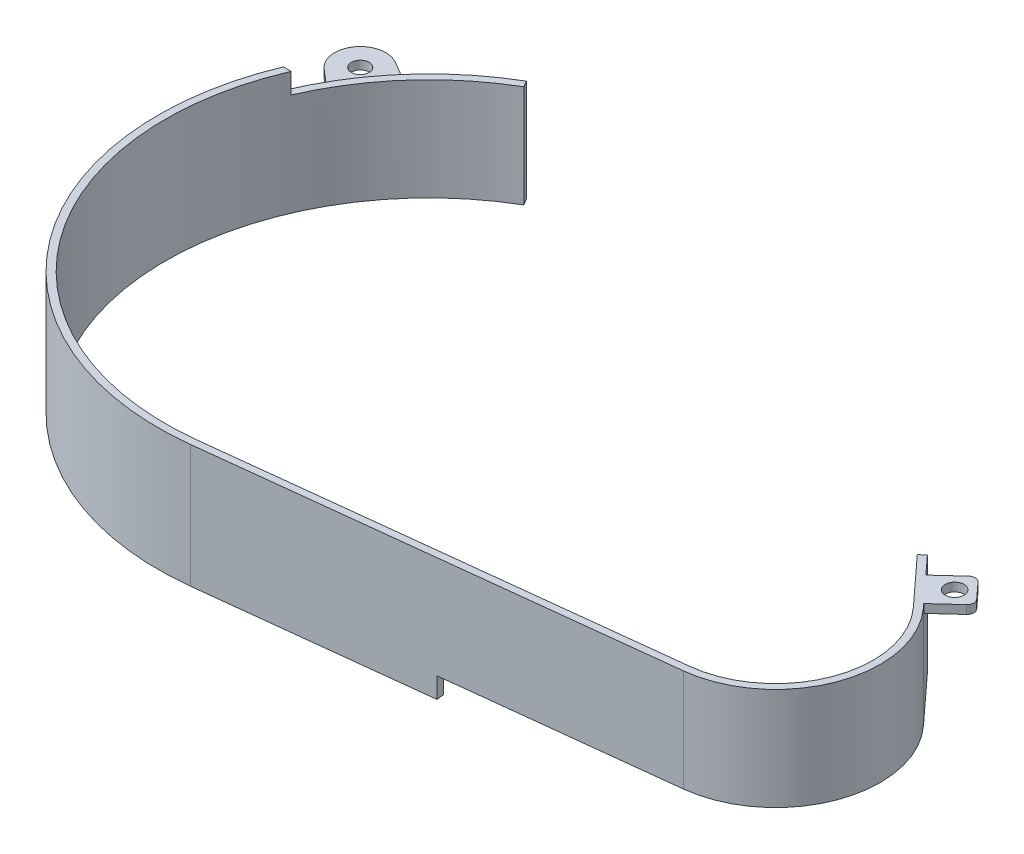
from build123d import *
from build123d.topology import SkipClean

# Parameters (mm, degrees)
BASE_FLANGE1_DEPTH  = 38.1
CUT_EXTRUDE1_DEPTH  = 7.62
BOSS_EXTRUDE1_DEPTH = 3.175
BOSS_EXTRUDE2_DEPTH = 7.62
SKETCH11_R          = 3.5
BOSS_EXTRUDE3_DEPTH = 3.175


# Sheet-metal steps are written as plain solids
with BuildPart() as part:
    # Sketch1 → Base-Flange1 (new body)
    with BuildSketch(Plane(origin=(0, 0, 0), x_dir=(1, 0, 0), z_dir=(0, 1, 0))):
        with BuildLine():
            Line((-658.18839, -181.815019342), (-493.414651072, -163.065661223))
            ThreePointArc((-493.414651072, -163.065661223), (-463.516823985, -139.706651468), (-470.767754496, -102.464908652))
            Line((-470.767754496, -102.464908652), (-487.062469778, -84.698684743))
            Line((-487.062469778, -84.698684743), (-485.096976273, -82.895985576))
            Line((-485.096976273, -82.895985576), (-468.802260992, -100.662209486))
            ThreePointArc((-468.802260992, -100.662209486), (-461.018573288, -140.640264051), (-493.113122906, -165.715561177))
            Line((-493.113122906, -165.715561177), (-657.886861835, -184.464919296))
            ThreePointArc((-657.886861835, -184.464919296), (-764.999542035, -116.070482162), (-720.157705771, 2.841817501))
            Line((-720.157705771, 2.841817501), (-718.812633408, 0.538847823))
            ThreePointArc((-718.812633408, 0.538847823), (-762.468736724, -115.229106217), (-658.18839, -181.815019342))
        make_face()
    extrude(amount=-BASE_FLANGE1_DEPTH)

    # Sketch7 → Cut-Extrude1 (cut)
    with BuildSketch(Plane(origin=(-720.157705771, 0, -2.841817501), x_dir=(1, 0, 0), z_dir=(0, 1, 0))):
        with BuildLine():
            Line((1.345072363, -2.302969678), (0, 0))
            ThreePointArc((0, 0), (-25.04555192, -20.685894616), (-42.216883241, -48.26))
            Line((-42.216883241, -48.26), (-39.320240627, -48.26))
            ThreePointArc((-39.320240627, -48.26), (-22.669860727, -22.023203588), (1.345072363, -2.302969678))
        make_face()
    extrude(amount=-CUT_EXTRUDE1_DEPTH, mode=Mode.SUBTRACT)

    # Sketch9 → Boss-Extrude1 (add)
    with BuildSketch(Plane(origin=(0, -11.93175668, 0), x_dir=(1, 0, 0), z_dir=(0, 1, 0))):
        with BuildLine():
            Line((-766.021160844, -26.574153948), (-756.947378036, -34.362103973))
            ThreePointArc((-756.947378036, -34.362103973), (-751.259248381, -25.482371354), (-744.675064761, -17.245078325))
            Line((-744.675064761, -17.245078325), (-754.96335975, -11.151090609))
            ThreePointArc((-754.96335975, -11.151090609), (-767.558577165, -13.796318349), (-766.021160844, -26.574153948))
        make_face()
        with BuildLine():
            ThreePointArc((-761.982172567, -21.837237166), (-757.32668993, -21.510922268), (-757.653004828, -16.85543963))
            ThreePointArc((-757.653004828, -16.85543963), (-762.308487465, -17.181754528), (-761.982172567, -21.837237166))
        make_face(mode=Mode.SUBTRACT)
    extrude(amount=-BOSS_EXTRUDE1_DEPTH)

    # Sketch10 → Boss-Extrude2 (add)
    with SkipClean():  # the faces are left unmerged after this step: merging them gives an invalid solid
        with BuildSketch(Plane.XZ.offset(38.1)):
            with BuildLine():
                Line((-718.812633408, -0.538847823), (-720.157705771, -2.841817501))
                ThreePointArc((-720.157705771, -2.841817501), (-764.999542035, 116.070482162), (-657.886861835, 184.464919296))
                Line((-657.886861835, 184.464919296), (-575.49999237, 175.090240236))
                Line((-575.49999237, 175.090240236), (-575.801520536, 172.440340282))
                Line((-575.801520536, 172.440340282), (-658.18839, 181.815019342))
                ThreePointArc((-658.18839, 181.815019342), (-762.468736724, 115.229106217), (-718.812633408, -0.538847823))
            make_face()
        extrude(amount=BOSS_EXTRUDE2_DEPTH)

    # Sketch11 → Boss-Extrude3 (add)
    with SkipClean():  # the faces are left unmerged after this step: merging them gives an invalid solid
        with BuildSketch(Plane(origin=(0, 0, 0), x_dir=(1, 0, 0), z_dir=(0, 1, 0))):
            with BuildLine():
                Line((-470.547014649, -82.037691541), (-478.876963309, -89.677702295))
                Line((-478.876963309, -89.677702295), (-470.089903254, -99.258285554))
                Line((-470.089903254, -99.258285554), (-461.759954594, -91.618274801))
                ThreePointArc((-461.759954594, -91.618274801), (-460.939178, -89.856007635), (-461.604912368, -88.029519876))
                Line((-461.604912368, -88.029519876), (-466.958259724, -82.192733767))
                ThreePointArc((-466.958259724, -82.192733767), (-468.72052689, -81.371957173), (-470.547014649, -82.037691541))
            make_face()
            with Locations(Location((-468.787614295, -89.074866795, 0), (0, 0, 270))):
                Circle(SKETCH11_R, mode=Mode.SUBTRACT)
        extrude(amount=-BOSS_EXTRUDE3_DEPTH)


solid = part.part
